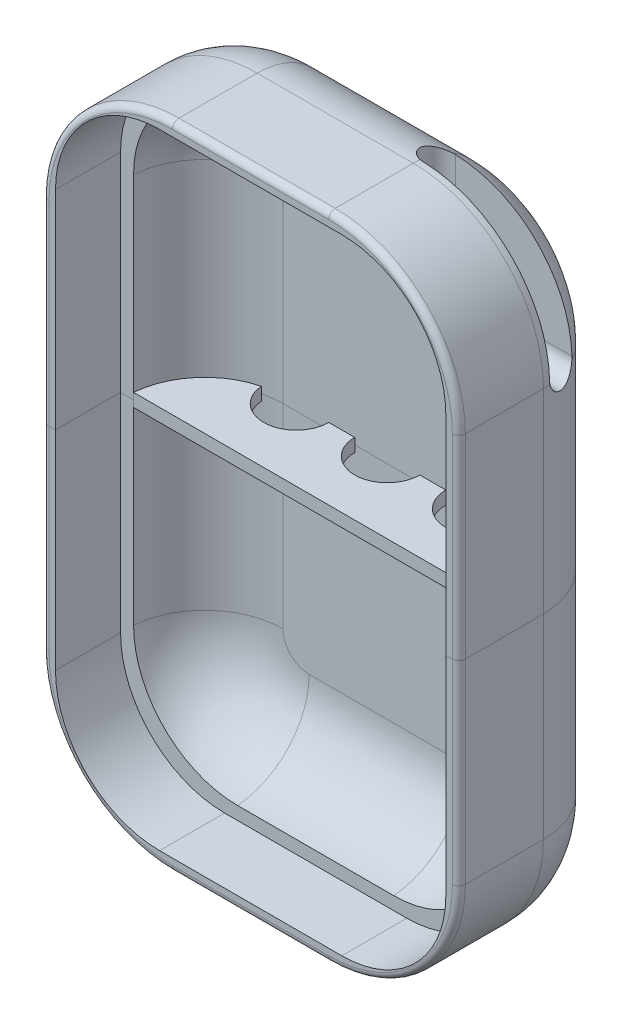
from build123d import *

# Parameters (mm, degrees)
SKETCH2_W           = 100
SKETCH2_H           = 25
BOSS_EXTRUDE3_DEPTH = 32
CUT_EXTRUDE1_DEPTH  = 10
CUT_EXTRUDE2_DEPTH  = 11
FILLET1_R           = 12
FILLET2_R           = 20
FILLET3_R           = 12
FILLET13_R          = 1
BOSS_EXTRUDE4_DEPTH = 1
CUT_EXTRUDE3_DEPTH  = 16
CUT_EXTRUDE4_DEPTH  = 16


with BuildPart() as part:
    # Sketch2 → Boss-Extrude3 (new, symmetric)
    with BuildSketch(Plane.YZ):
        with Locations((0, 12.5)):
            Rectangle(SKETCH2_W, SKETCH2_H)
    extrude(amount=BOSS_EXTRUDE3_DEPTH, both=True)

    # Sketch3 → Cut-Extrude1 (cut)
    with BuildSketch(Plane.XY.offset(25)):
        with BuildLine():
            Line((-30, 0), (-30, -32))
            ThreePointArc((-30, -32), (-25.313708499, -43.313708499), (-14, -48))
            Line((-14, -48), (14, -48))
            ThreePointArc((14, -48), (25.313708499, -43.313708499), (30, -32))
            Line((30, -32), (30, 0))
            Line((30, 0), (-30, 0))
        make_face()
    extrude(amount=-CUT_EXTRUDE1_DEPTH, mode=Mode.SUBTRACT)

    # Sketch4 → Cut-Extrude2 (cut)
    with BuildSketch(Plane.XY.offset(15)):
        with BuildLine():
            Line((-28, 0), (28, 0))
            Line((28, 0), (28, -30))
            ThreePointArc((28, -30), (23.313708499, -41.313708499), (12, -46))
            Line((12, -46), (-12, -46))
            ThreePointArc((-12, -46), (-23.313708499, -41.313708499), (-28, -30))
            Line((-28, -30), (-28, 0))
        make_face()
    extrude(amount=-CUT_EXTRUDE2_DEPTH, mode=Mode.SUBTRACT)

    # SurfaceCut2
    split(bisect_by=Plane(origin=(0, 0, 0), x_dir=(-1, 0, 0), z_dir=(0, 1, 0)), keep=Keep.BOTTOM)

    # Fillet1
    # the kernel refuses this fillet: 12 mm, written as the material it adds along each edge
    with BuildSketch(Plane(origin=(-28, -30, 4), x_dir=(1, 0, 0), z_dir=(0, 1, 0))) as fillet1_piece_1:
        with BuildLine():
            CenterArc((11.958260743, -12), FILLET1_R, 90, 85.219808153)
            Line((0, -11), (-0.239165215, -10.98))
            ThreePointArc((-0.239165215, -10.98), (-0.24, -5.5), (-0.24, 0))
            Line((-0.24, 0), (0, 0.24))
            Line((0, 0.24), (11.958260743, 0.24))
            Line((11.958260743, 0.24), (11.958260743, 0))
        make_face()
    extrude(amount=30)
    with BuildSketch(Plane(origin=(28, 0, 4), x_dir=(0, 0, 1), z_dir=(0, -1, 0))) as fillet1_piece_2:
        with BuildLine():
            CenterArc((12, 11.958260743), FILLET1_R, 180, 85.219808153)
            Line((0, 11.958260743), (-0.24, 11.958260743))
            Line((-0.24, 11.958260743), (-0.24, 0))
            Line((-0.24, 0), (0, -0.24))
            ThreePointArc((0, -0.24), (5.5, -0.24), (10.98, -0.239165215))
            Line((10.98, -0.239165215), (11, 0))
        make_face()
    extrude(amount=30)
    with BuildSketch(Plane(origin=(12, -30, 4), x_dir=(1, 0, 0), z_dir=(0, 1, 0))) as fillet1_piece_3:
        with BuildLine():
            CenterArc((4.041739257, -12), FILLET1_R, 4.780191847, 85.219808153)
            Line((16, -11), (16.239165215, -10.98))
            ThreePointArc((16.239165215, -10.98), (16.24, -5.5), (16.24, 0))
            Line((16.24, 0), (16, 0.24))
            Line((16, 0.24), (4.041739257, 0.24))
            Line((4.041739257, 0.24), (4.041739257, 0))
        make_face()
    revolve(axis=Axis((12, -30, 4), (0, 0, -1)), revolution_arc=90)
    with BuildSketch(Plane(origin=(12, -46, 4), x_dir=(0, 1, 0), z_dir=(-1, 0, 0))) as fillet1_piece_4:
        with BuildLine():
            CenterArc((11.958260743, -12), FILLET1_R, 90, 85.219808153)
            Line((0, -11), (-0.239165215, -10.98))
            ThreePointArc((-0.239165215, -10.98), (-0.24, -5.5), (-0.24, 0))
            Line((-0.24, 0), (0, 0.24))
            Line((0, 0.24), (11.958260743, 0.24))
            Line((11.958260743, 0.24), (11.958260743, 0))
        make_face()
    extrude(amount=24)
    with BuildSketch(Plane(origin=(-12, -30, 4), x_dir=(0, -1, 0), z_dir=(1, 0, 0))) as fillet1_piece_5:
        with BuildLine():
            CenterArc((4.041739257, -12), FILLET1_R, 4.780191847, 85.219808153)
            Line((16, -11), (16.239165215, -10.98))
            ThreePointArc((16.239165215, -10.98), (16.24, -5.5), (16.24, 0))
            Line((16.24, 0), (16, 0.24))
            Line((16, 0.24), (4.041739257, 0.24))
            Line((4.041739257, 0.24), (4.041739257, 0))
        make_face()
    revolve(axis=Axis((-12, -30, 4), (0, 0, -1)), revolution_arc=90)

    # Fillet2
    fillet2_edges = [part.edges().sort_by_distance(p)[0] for p in [
        (32, -50, 12.5),
        (-32, -50, 12.5),
    ]]
    fillet(fillet2_edges, radius=FILLET2_R)

    # Fillet3
    fillet3_edges = [part.edges().sort_by_distance(p)[0] for p in [
        (0, -50, 0),
        (32, -15, 0),
        (-32, -15, 0),
        (26.142135624, -44.142135624, 0),
        (-26.142135624, -44.142135624, 0),
    ]]
    fillet(fillet3_edges, radius=FILLET3_R)

    # Fillet13
    fillet13_edges = [part.edges().sort_by_distance(p)[0] for p in [
        (-32, -15, 25),
        (32, -15, 25),
        (0, -50, 25),
        (26.142135624, -44.142135624, 25),
        (-26.142135624, -44.142135624, 25),
    ]]
    fillet(fillet13_edges, radius=FILLET13_R)


with BuildPart() as body_2:
    # Sketch7 → Boss-Extrude4 (new, symmetric)
    with BuildSketch(Plane(origin=(0, 0, 0), x_dir=(-1, 0, 0), z_dir=(0, 1, 0))):
        with BuildLine():
            ThreePointArc((-24.165777662, 7.168239134), (-21.750636592, 5.444977915), (-18.986517938, 4.366931681))
            ThreePointArc((-18.986517938, 4.366931681), (-13.81641036, 8.996628348), (-9, 4))
            Line((-9, 4), (-5, 4))
            ThreePointArc((-5, 4), (0, 9), (5, 4))
            Line((5, 4), (9, 4))
            ThreePointArc((9, 4), (13.81641036, 8.996628348), (18.986517938, 4.366931681))
            ThreePointArc((18.986517938, 4.366931681), (25.195464263, 8.240533619), (28, 15))
            Line((28, 15), (-28, 15))
            ThreePointArc((-28, 15), (-26.819438656, 10.723524314), (-24.165777662, 7.168239134))
        make_face()
    extrude(amount=BOSS_EXTRUDE4_DEPTH, both=True)


with BuildPart() as body_3:
    # Mirror2: read off the stored shape, not the designer's step
    # Mirror2: mirrored copy
    add(part.part.mirror(Plane(origin=(0, 0, 0), x_dir=(1, 0, 0), z_dir=(0, 1, 0))))

    # Sketch9 → Cut-Extrude3 (cut)
    with BuildSketch(Plane.YZ.offset(32)):
        with BuildLine():
            Line((30.5, 11), (54.187598308, 11))
            ThreePointArc((54.187598308, 11), (56.687598308, 8.5), (54.187598308, 6))
            Line((54.187598308, 6), (30.5, 6))
            ThreePointArc((30.5, 6), (28, 8.5), (30.5, 11))
        make_face()
    extrude(amount=-CUT_EXTRUDE3_DEPTH, mode=Mode.SUBTRACT)

    # Sketch10 → Cut-Extrude4 (cut)
    with BuildSketch(Plane(origin=(0, 50, 0), x_dir=(-1, 0, 0), z_dir=(0, 1, 0))):
        with BuildLine():
            Line((-30.093221435, 11), (-12.5, 11))
            ThreePointArc((-12.5, 11), (-10, 8.5), (-12.5, 6))
            Line((-12.5, 6), (-30.093221435, 6))
            ThreePointArc((-30.093221435, 6), (-32.593221435, 8.5), (-30.093221435, 11))
        make_face()
    extrude(amount=-CUT_EXTRUDE4_DEPTH, mode=Mode.SUBTRACT)


solid = Compound([part.part, body_2.part, body_3.part])
